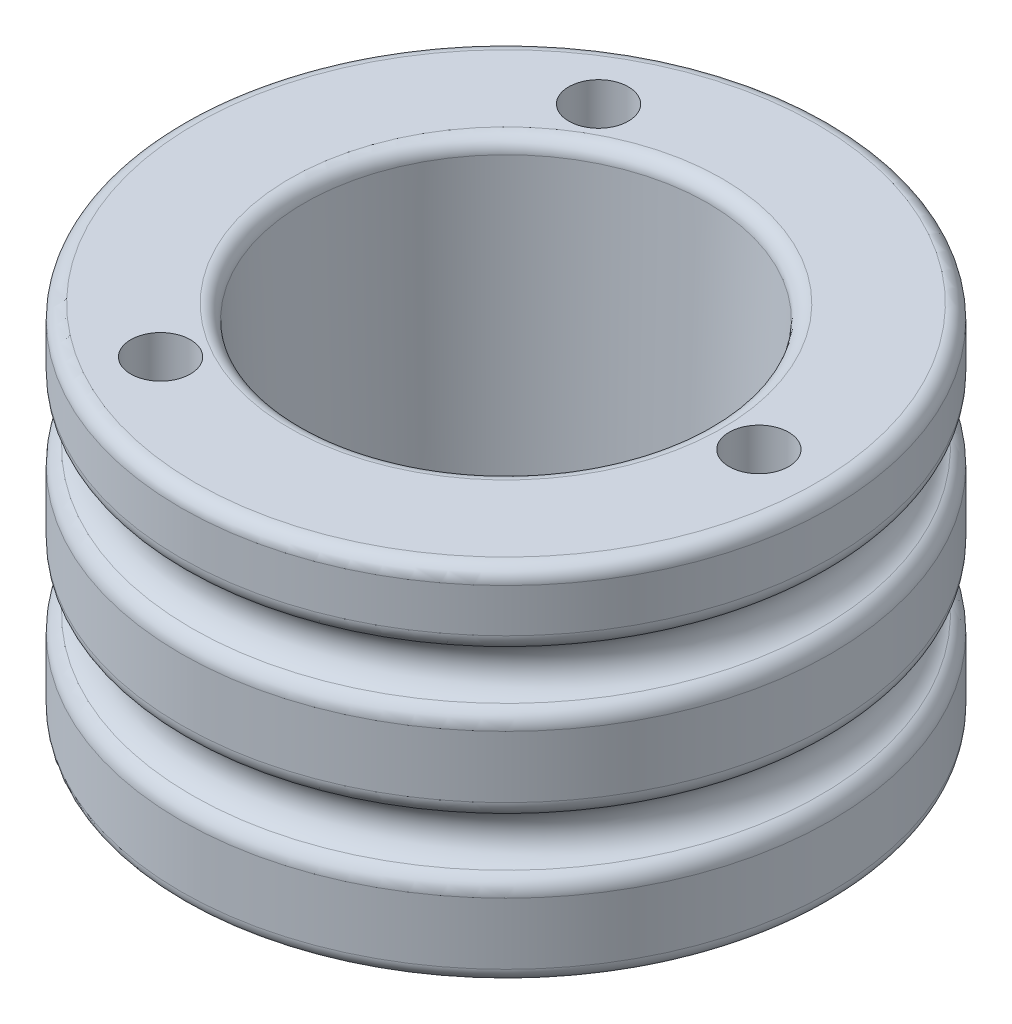
from build123d import *
from OCP.BRepFilletAPI import BRepFilletAPI_MakeFillet

# Parameters (mm, degrees)
ESQUISSE2_R             = 1.65
ENL_V_MAT_EXTRU_1_DEPTH = 33.372828112
ENL_V_MAT_EXTRU_2_DEPTH = 3
CHANFREIN1_SIZE         = 0.6
CHANFREIN1_SIZE_2       = 17.18175197
CONG_1_R1               = 1
CONG_1_R2               = 0.8
ESQUISSE4_R             = 1.5
BOSS_EXTRU_1_DEPTH      = 0.3
CONG_3_R                = 1


with BuildPart() as part:
    # Esquisse1 → Révolution1 (revolve)
    with BuildSketch(Plane.XY, mode=Mode.PRIVATE) as r_volution1_sk:
        with BuildLine():
            Line((18, 17), (10.6, 17))
            Line((10.6, 17), (10.6, 1))
            Line((10.6, 1), (9.6, 1))
            Line((9.6, 1), (9.6, 0.7))
            Line((9.6, 0.7), (5.3, 0.7))
            Line((5.3, 0.7), (5.3, 1))
            Line((5.3, 1), (3.3, 1))
            Line((3.3, 1), (3.3, 0))
            Line((3.3, 0), (10.578545573, -3))
            Line((10.578545573, -3), (18, -3))
            Line((18, -3), (18, 2))
            ThreePointArc((18, 2), (16.5, 3.5), (18, 5))
            Line((18, 5), (18, 10))
            ThreePointArc((18, 10), (16.5, 11.5), (18, 13))
            Line((18, 13), (18, 17))
        make_face()
    revolve(r_volution1_sk.sketch.rotate(Axis((0, 8, 0), (0, -1, 0)), 90), axis=Axis((0, 8, 0), (0, -1, 0)))

    # Esquisse2 → Enlèv. mat.-Extru.1 (cut, through all)
    with BuildSketch(Plane(origin=(0, 17, 0), x_dir=(1, 0, 0), z_dir=(0, 1, 0))):
        with Locations(Location((14, 0, 0), (0, 0, 270))):
            Circle(ESQUISSE2_R)
        with Locations(Location((-7, -12.124355653, 0), (0, 0, 270))):
            Circle(ESQUISSE2_R)
        with Locations(Location((-7, 12.124355653, 0), (0, 0, 270))):
            Circle(ESQUISSE2_R)
    extrude(amount=-ENL_V_MAT_EXTRU_1_DEPTH, mode=Mode.SUBTRACT)

    # Esquisse3 → Enlèv. mat.-Extru.2 (cut)
    with BuildSketch(Plane.XZ.offset(3)):
        Polygon((14, -3.464101615), (17, -1.732050808), (17, 1.732050808), (14, 3.464101615), (11, 1.732050808), (11, -1.732050808), align=None)
        Polygon((-7, -8.660254038), (-10, -10.392304845), (-10, -13.856406461), (-7, -15.588457268), (-4, -13.856406461), (-4, -10.392304845), align=None)
        Polygon((-4, 10.392304845), (-4, 13.856406461), (-7, 15.588457268), (-10, 13.856406461), (-10, 10.392304845), (-7, 8.660254038), align=None)
    extrude(amount=-ENL_V_MAT_EXTRU_2_DEPTH, mode=Mode.SUBTRACT)

    # Chanfrein1
    # the kernel refuses this chamfer: 17.18175197, 0.6 mm, written as the material it takes off along each edge
    with BuildSketch(Plane(origin=(0, 17, 0), x_dir=(0, 0, 1), z_dir=(1, 0, 0))) as chanfrein1_piece_1_section:
        Polygon((10.6 + CHANFREIN1_SIZE, 0), (10.6, CHANFREIN1_SIZE_2), (10.6, 0), align=None)
    chanfrein1_piece_1 = revolve(axis=Axis((0, 17, 0), (0, -1, 0)), mode=Mode.PRIVATE)
    chanfrein1_piece_1 = split(chanfrein1_piece_1, bisect_by=Plane(origin=(0, 1, -10.842656471), z_dir=(0, 1, 0)), keep=Keep.TOP, mode=Mode.PRIVATE)
    add(chanfrein1_piece_1, mode=Mode.SUBTRACT)

    # Congé1: one fillet with a radius per group of edges: ONE call of the kernel's fillet builder (fillet() takes one radius for all edges)
    cong_1_edges_1 = [part.edges().sort_by_distance(p)[0] for p in [
        (0, -3, -10.578545573),
    ]]
    cong_1_edges_2 = [part.edges().sort_by_distance(p)[0] for p in [
        (0, 17, -11.2),
        (0, -3, -18),
        (0, 17, -18),
    ]]
    cong_1 = BRepFilletAPI_MakeFillet(part.part.solid().wrapped)
    for e in cong_1_edges_1:
        cong_1.Add(CONG_1_R1, e.wrapped)
    for e in cong_1_edges_2:
        cong_1.Add(CONG_1_R2, e.wrapped)
    add(Compound.cast(cong_1.Shape()), mode=Mode.REPLACE)

    # Esquisse4 → Boss.-Extru.1 (add)
    with BuildSketch(Plane(origin=(0, 0.7, 0), x_dir=(1, 0, 0), z_dir=(0, 1, 0))):
        with Locations(Location((0, 7.5, 0), (0, 0, 90))):
            Circle(ESQUISSE4_R)
        with Locations(Location((0, -7.5, 0), (0, 0, 90))):
            Circle(ESQUISSE4_R)
    extrude(amount=BOSS_EXTRU_1_DEPTH)

    # Congé3
    cong_3_edges = [part.edges().sort_by_distance(p)[0] for p in [
        (0, 2, -18),
        (0, 13, -18),
        (0, 10, -18),
        (0, 5, -18),
    ]]
    fillet(cong_3_edges, radius=CONG_3_R)


solid = part.part
